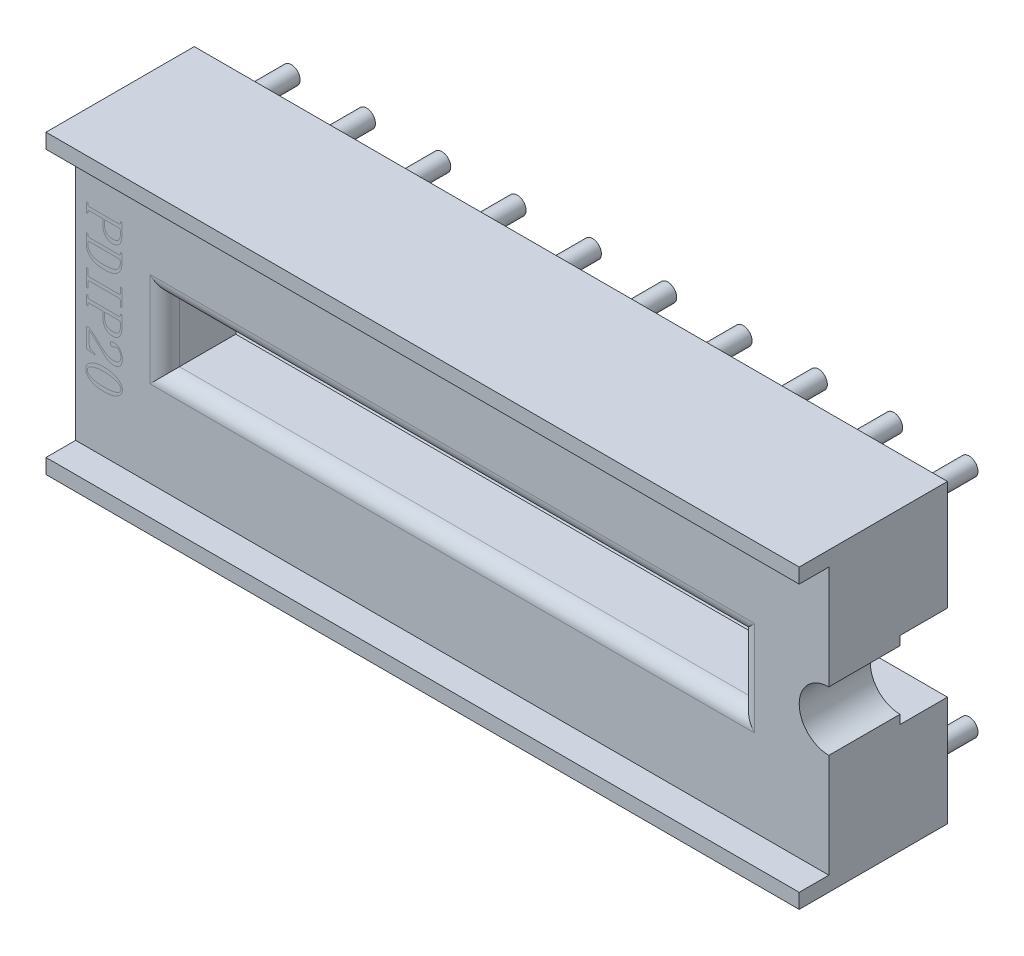
from build123d import *

# Parameters (mm, degrees)
EXTRUDE_1_DEPTH     = 5
SKETCH_2_W          = 1
SKETCH_2_H          = 9
SKETCH_2_W_2        = 1.6
SKETCH_2_H_2        = 2.6
CUT_EXTRUDE_1_DEPTH = 28.751756701
CUT_EXTRUDE_2_REACH = 29.589
SKETCH_3_W          = 19.4
SKETCH_3_H          = 2.2
SKETCH_4_R          = 0.3
EXTRUDE_2_DEPTH     = 2
FILLET_1_R          = 0.5


with BuildPart() as part:
    # 草图1 → 凸台-拉伸1 (new body)
    with BuildSketch(Plane.XY):
        with BuildLine():
            Line((0, 0), (25.4, 0))
            Line((25.4, 0), (25.4, 4))
            ThreePointArc((25.4, 4), (24.4, 5), (25.4, 6))
            Line((25.4, 6), (25.4, 10))
            Line((25.4, 10), (0, 10))
            Line((0, 10), (0, 0))
        make_face()
    extrude(amount=EXTRUDE_1_DEPTH)

    # 草图2 → 切除-拉伸1 (cut, through all)
    with BuildSketch(Plane(origin=(25.4, 0, 0), x_dir=(0, 0, -1), z_dir=(1, 0, 0))):
        with Locations((-4.5, 5)):
            Rectangle(SKETCH_2_W, SKETCH_2_H)
        with Locations((-0.8, 5)):
            Rectangle(SKETCH_2_W_2, SKETCH_2_H_2)
    extrude(amount=-CUT_EXTRUDE_1_DEPTH, mode=Mode.SUBTRACT)

    # 草图3 → 切除-拉伸2 (cut, up to next)
    with BuildSketch(Plane.XY.offset(4), mode=Mode.PRIVATE) as cut_extrude_2_sk1:
        with Locations((12.7, 5)):
            Rectangle(SKETCH_3_W, SKETCH_3_H)
    cut_extrude_2_tool1 = extrude(cut_extrude_2_sk1.sketch, amount=-CUT_EXTRUDE_2_REACH, mode=Mode.PRIVATE) & part.part
    add(cut_extrude_2_tool1.solids().sort_by_distance((12.7, 5, 4))[0], mode=Mode.SUBTRACT)

    # 草图4 → 凸台-拉伸2 (add)
    with BuildSketch(Plane(origin=(0, 0, 0), x_dir=(-1, 0, 0), z_dir=(0, 0, -1))):
        with Locations((-11.43, 8.81)):
            Circle(SKETCH_4_R)
        with Locations((-8.89, 1.19)):
            Circle(SKETCH_4_R)
        with Locations((-13.97, 8.81)):
            Circle(SKETCH_4_R)
        with Locations((-8.89, 8.81)):
            Circle(SKETCH_4_R)
        with Locations((-6.35, 1.19)):
            Circle(SKETCH_4_R)
        with Locations((-13.97, 1.19)):
            Circle(SKETCH_4_R)
        with Locations((-11.43, 1.19)):
            Circle(SKETCH_4_R)
        with Locations((-6.35, 8.81)):
            Circle(SKETCH_4_R)
        with Locations((-3.81, 1.19)):
            Circle(SKETCH_4_R)
        with Locations((-3.81, 8.81)):
            Circle(SKETCH_4_R)
        with Locations((-1.27, 1.19)):
            Circle(SKETCH_4_R)
        with Locations((-1.27, 8.81)):
            Circle(SKETCH_4_R)
        with Locations((-16.51, 1.19)):
            Circle(SKETCH_4_R)
        with Locations((-16.51, 8.81)):
            Circle(SKETCH_4_R)
        with Locations((-19.05, 1.19)):
            Circle(SKETCH_4_R)
        with Locations((-19.05, 8.81)):
            Circle(SKETCH_4_R)
        with Locations((-21.59, 1.19)):
            Circle(SKETCH_4_R)
        with Locations((-21.59, 8.81)):
            Circle(SKETCH_4_R)
        with Locations((-24.13, 1.19)):
            Circle(SKETCH_4_R)
        with Locations((-24.13, 8.81)):
            Circle(SKETCH_4_R)
    extrude(amount=EXTRUDE_2_DEPTH)

    # 圆角1
    fillet_1_edges = [part.edges().sort_by_distance(p)[0] for p in [
        (3, 5, 4),
        (12.7, 3.9, 4),
        (22.4, 5, 4),
        (12.7, 6.1, 4),
    ]]
    fillet(fillet_1_edges, radius=FILLET_1_R)


solid = part.part
